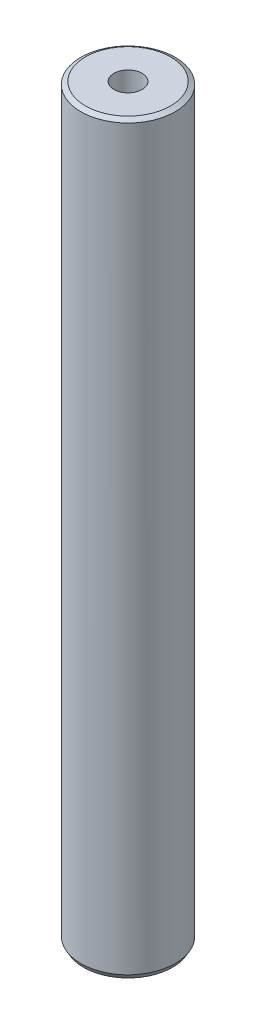
from build123d import *
from OCP.BRepFilletAPI import BRepFilletAPI_MakeChamfer

# Parameters (mm, degrees)
SKETCH1_R           = 37.5
BOSS_EXTRUDE1_DEPTH = 591.938683053
SKETCH2_R           = 11.177949508
CUT_EXTRUDE1_DEPTH  = 595.309603233
CHAMFER1_SIZE       = 2.126675714
CHAMFER1_SIZE2      = 3.700159207


with BuildPart() as part:
    # Sketch1 → Boss-Extrude1 (new body)
    with BuildSketch(Plane(origin=(0, 0, 0), x_dir=(1, 0, 0), z_dir=(0, 1, 0))):
        Circle(SKETCH1_R)
    extrude(amount=BOSS_EXTRUDE1_DEPTH)

    # Sketch2 → Cut-Extrude1 (cut, through all)
    with BuildSketch(Plane(origin=(0, 0, 0), x_dir=(1, 0, 0), z_dir=(0, 1, 0))):
        Circle(SKETCH2_R)
    extrude(amount=CUT_EXTRUDE1_DEPTH, mode=Mode.SUBTRACT)

    # Chamfer1: one chamfer whose edges measure the first distance from different faces: ONE call of the kernel's chamfer builder (chamfer() names one face for all edges)
    chamfer1_edges_1 = [part.edges().sort_by_distance(p)[0] for p in [
        (-37.5, 591.938683053, 0),
    ]]
    chamfer1_side_1 = [part.faces().sort_by_distance(p)[0] for p in [
        (-37.5, 295.969341527, 0),
    ]]
    chamfer1_edges_2 = [part.edges().sort_by_distance(p)[0] for p in [
        (-37.5, 0, 0),
    ]]
    chamfer1_side_2 = [part.faces().sort_by_distance(p)[0] for p in [
        (-36.439339828, 0, 0),
    ]]
    chamfer1 = BRepFilletAPI_MakeChamfer(part.part.solid().wrapped)
    for e in chamfer1_edges_1:
        chamfer1.Add(CHAMFER1_SIZE, CHAMFER1_SIZE2, e.wrapped, chamfer1_side_1[0].wrapped)  # the first distance lies on this face
    for e in chamfer1_edges_2:
        chamfer1.Add(CHAMFER1_SIZE, CHAMFER1_SIZE2, e.wrapped, chamfer1_side_2[0].wrapped)  # the first distance lies on this face
    add(Compound.cast(chamfer1.Shape()), mode=Mode.REPLACE)


solid = part.part
